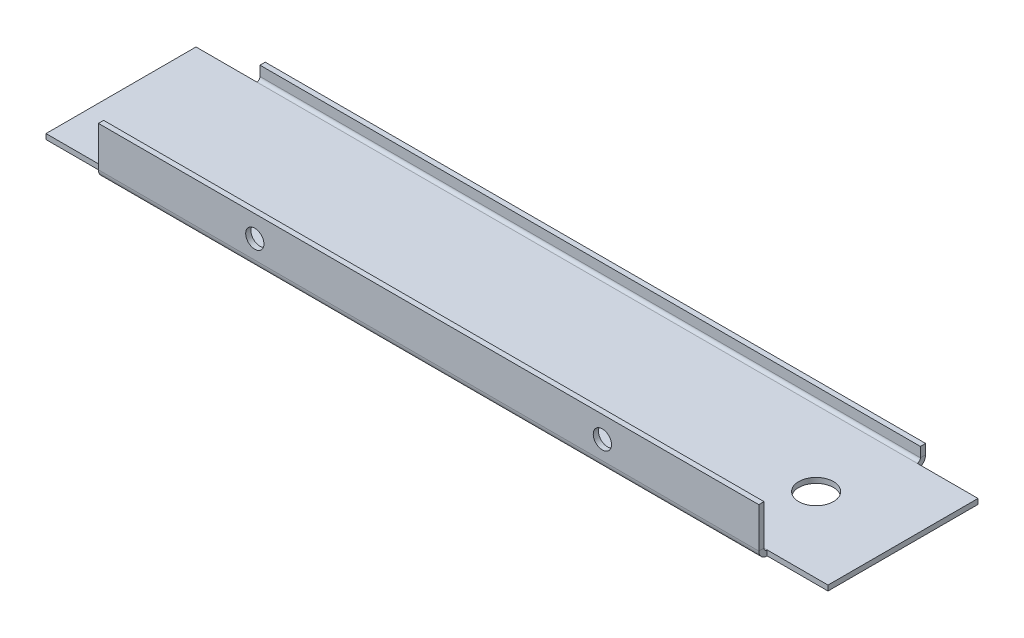
from build123d import *

# Parameters (mm, degrees)
FLANGE_BASE2_DEPTH      = 90
CORTE_EXTRUS_O3_START   = -90
CORTE_EXTRUS_O3_DEPTH   = 14
CORTE_EXTRUS_O3_START_2 = 76
CORTE_EXTRUS_O3_2_DEPTH = 14
ESBO_O13_R              = 4
CORTE_EXTRUS_O4_DEPTH   = 93.704260959
ESBO_O14_R              = 2.1
CORTE_EXTRUS_O5_DEPTH   = 98.897088823


# Read off the part's stored shape, not the designer's step: Corte-extrusão3
# Sheet-metal steps are written as plain solids
with BuildPart() as part:
    # Esboço1 → Flange-base2 (new, symmetric)
    with BuildSketch(Plane(origin=(0, 0, 0), x_dir=(0, 0, -1), z_dir=(1, 0, 0))):
        with BuildLine():
            Line((-18, 10), (-18, 0.7366))
            ThreePointArc((-18, 0.7366), (-17.784254855, 0.215745145), (-17.2634, 0))
            Line((-17.2634, 0), (17.2634, 0))
            ThreePointArc((17.2634, 0), (17.784254855, 0.215745145), (18, 0.7366))
            Line((18, 0.7366), (18, 3))
            Line((18, 3), (19.2, 3))
            Line((19.2, 3), (19.2, 0.7366))
            ThreePointArc((19.2, 0.7366), (18.632782992, -0.632782992), (17.2634, -1.2))
            Line((17.2634, -1.2), (-17.2634, -1.2))
            ThreePointArc((-17.2634, -1.2), (-18.632782992, -0.632782992), (-19.2, 0.7366))
            Line((-19.2, 0.7366), (-19.2, 10))
            Line((-19.2, 10), (-18, 10))
        make_face()
    extrude(amount=FLANGE_BASE2_DEPTH, both=True)

    # Corte-extrusão3 outline → Corte-extrusão3 (cut)
    with BuildSketch(Plane.YZ.offset(CORTE_EXTRUS_O3_START)):
        with BuildLine():
            Line((-1.2, 17.2634), (0, 17.2634))
            ThreePointArc((0, 17.2634), (0.215745145, 17.784254855), (0.7366, 18))
            Line((0.7366, 18), (10, 18))
            Line((10, 18), (10, 19.2))
            Line((10, 19.2), (0.7366, 19.2))
            ThreePointArc((0.7366, 19.2), (-0.632782992, 18.632782992), (-1.2, 17.2634))
        make_face()
        with BuildLine():
            ThreePointArc((0.7366, -18), (0.215745145, -17.784254855), (0, -17.2634))
            Line((0, -17.2634), (-1.2, -17.2634))
            ThreePointArc((-1.2, -17.2634), (-0.632782992, -18.632782992), (0.7366, -19.2))
            Line((0.7366, -19.2), (3, -19.2))
            Line((3, -19.2), (3, -18))
            Line((3, -18), (0.7366, -18))
        make_face()
    extrude(amount=CORTE_EXTRUS_O3_DEPTH, mode=Mode.SUBTRACT)

    # Corte-extrus_o3 2 outline → Corte-extrus_o3 2 (cut)
    with BuildSketch(Plane.YZ.offset(CORTE_EXTRUS_O3_START_2)):
        with BuildLine():
            Line((-1.2, 17.2634), (0, 17.2634))
            ThreePointArc((0, 17.2634), (0.215745145, 17.784254855), (0.7366, 18))
            Line((0.7366, 18), (10, 18))
            Line((10, 18), (10, 19.2))
            Line((10, 19.2), (0.7366, 19.2))
            ThreePointArc((0.7366, 19.2), (-0.632782992, 18.632782992), (-1.2, 17.2634))
        make_face()
        with BuildLine():
            ThreePointArc((0.7366, -18), (0.215745145, -17.784254855), (0, -17.2634))
            Line((0, -17.2634), (-1.2, -17.2634))
            ThreePointArc((-1.2, -17.2634), (-0.632782992, -18.632782992), (0.7366, -19.2))
            Line((0.7366, -19.2), (3, -19.2))
            Line((3, -19.2), (3, -18))
            Line((3, -18), (0.7366, -18))
        make_face()
    extrude(amount=CORTE_EXTRUS_O3_2_DEPTH, mode=Mode.SUBTRACT)

    # Esboço13 → Corte-extrusão4 (cut, through all)
    with BuildSketch(Plane.XZ.offset(1.2)):
        with Locations(Location((70, 0, 0), (0, 0, 270))):
            Circle(ESBO_O13_R)
    extrude(amount=-CORTE_EXTRUS_O4_DEPTH, mode=Mode.SUBTRACT)

    # Esboço14 → Corte-extrusão5 (cut, through all)
    with BuildSketch(Plane(origin=(0, 0, 18), x_dir=(-1, 0, 0), z_dir=(0, 0, -1))):
        with Locations((-40, 5)):
            Circle(ESBO_O14_R)
        with Locations((40, 5)):
            Circle(ESBO_O14_R)
    extrude(amount=-CORTE_EXTRUS_O5_DEPTH, mode=Mode.SUBTRACT)


solid = part.part
